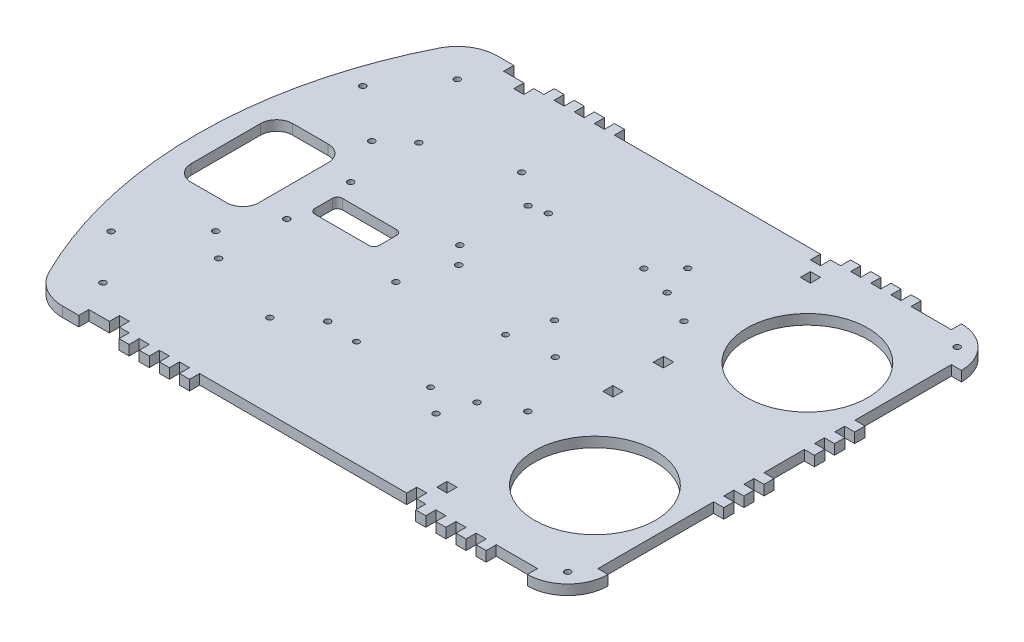
from build123d import *

# Parameters (mm, degrees)
MAIN_BASE_SKETCH_R   = 38.1
MAIN_BASE_SKETCH_R_2 = 1.905
MAIN_BASE_SKETCH_W   = 6.302603838
MAIN_BASE_SKETCH_H   = 6.555527471
MAIN_BASE_SKETCH_W_2 = 6.35
MAIN_BASE_SKETCH_H_2 = 6.35
MAIN_BASE_DEPTH      = 6.35
SKETCH1_R            = 1.905
SKETCH1_R_2          = 1.796
CUT_EXTRUDE1_DEPTH   = 257.294778557


with BuildPart() as part:
    # main_base_sketch → main_base (new body)
    with BuildSketch(Plane(origin=(0, 0, 0), x_dir=(1, 0, 0), z_dir=(0, 1, 0))):
        with BuildLine():
            Line((-94.961375831, 124.478458264), (-82.261375831, 124.478458264))
            Line((-82.261375831, 124.478458264), (-82.261375831, 118.128458264))
            Line((-82.261375831, 118.128458264), (-75.911375831, 118.128458264))
            Line((-75.911375831, 118.128458264), (-75.911375831, 124.478458264))
            Line((-75.911375831, 124.478458264), (-69.561375831, 124.478458264))
            Line((-69.561375831, 124.478458264), (-69.561375831, 130.828458264))
            Line((-69.561375831, 130.828458264), (-63.211375831, 130.828458264))
            Line((-63.211375831, 130.828458264), (-63.211375831, 124.478458264))
            Line((-63.211375831, 124.478458264), (-56.861375831, 124.478458264))
            Line((-56.861375831, 124.478458264), (-56.861375831, 130.828458264))
            Line((-56.861375831, 130.828458264), (-50.511375831, 130.828458264))
            Line((-50.511375831, 130.828458264), (-50.511375831, 124.478458264))
            Line((-50.511375831, 124.478458264), (-44.161375831, 124.478458264))
            Line((-44.161375831, 124.478458264), (-44.161375831, 130.828458264))
            Line((-44.161375831, 130.828458264), (-37.811375831, 130.828458264))
            Line((-37.811375831, 130.828458264), (-37.811375831, 124.478458264))
            Line((-37.811375831, 124.478458264), (-31.461375831, 124.478458264))
            Line((-31.461375831, 124.478458264), (-31.461375831, 130.828458264))
            Line((-31.461375831, 130.828458264), (-25.111375831, 130.828458264))
            Line((-25.111375831, 130.828458264), (-25.111375831, 124.478458264))
            Line((-25.111375831, 124.478458264), (104.775, 124.478458264))
            Line((104.775, 124.478458264), (104.775, 118.128458264))
            Line((104.775, 118.128458264), (111.125, 118.128458264))
            Line((111.125, 118.128458264), (111.125, 124.478458264))
            Line((111.125, 124.478458264), (117.475, 124.478458264))
            Line((117.475, 124.478458264), (117.475, 130.828458264))
            Line((117.475, 130.828458264), (123.825, 130.828458264))
            Line((123.825, 130.828458264), (123.825, 124.478458264))
            Line((123.825, 124.478458264), (130.175, 124.478458264))
            Line((130.175, 124.478458264), (130.175, 130.828458264))
            Line((130.175, 130.828458264), (136.525, 130.828458264))
            Line((136.525, 130.828458264), (136.525, 124.478458264))
            Line((136.525, 124.478458264), (142.875, 124.478458264))
            Line((142.875, 124.478458264), (142.875, 130.828458264))
            Line((142.875, 130.828458264), (149.225, 130.828458264))
            Line((149.225, 130.828458264), (149.225, 124.478458264))
            Line((149.225, 124.478458264), (155.575, 124.478458264))
            Line((155.575, 124.478458264), (155.575, 130.828458264))
            Line((155.575, 130.828458264), (161.925, 130.828458264))
            Line((161.925, 130.828458264), (161.925, 124.478458264))
            Line((161.925, 124.478458264), (187.325, 124.478458264))
            Line((187.325, 124.478458264), (187.325, 130.828458264))
            ThreePointArc((187.325, 130.828458264), (205.285512242, 123.388970506), (212.725, 105.428458264))
            Line((212.725, 105.428458264), (206.375, 105.428458264))
            Line((206.375, 105.428458264), (206.375, 44.655527471))
            Line((206.375, 44.655527471), (212.725, 44.655527471))
            Line((212.725, 44.655527471), (212.725, 38.1))
            Line((212.725, 38.1), (206.375, 38.1))
            Line((206.375, 38.1), (206.375, 31.955527471))
            Line((206.375, 31.955527471), (212.725, 31.955527471))
            Line((212.725, 31.955527471), (212.725, 25.4))
            Line((212.725, 25.4), (206.375, 25.4))
            Line((206.375, 25.4), (206.375, 24.179190074))
            Line((206.375, 24.179190074), (206.375, 19.255527471))
            Line((206.375, 19.255527471), (212.725, 19.255527471))
            Line((212.725, 19.255527471), (212.725, 12.7))
            Line((212.725, 12.7), (206.375, 12.7))
            Line((206.375, 12.7), (206.375, -12.7))
            Line((206.375, -12.7), (212.725, -12.7))
            Line((212.725, -12.7), (212.725, -19.05))
            Line((212.725, -19.05), (206.375, -19.05))
            Line((206.375, -19.05), (206.375, -25.4))
            Line((206.375, -25.4), (212.725, -25.4))
            Line((212.725, -25.4), (212.725, -31.75))
            Line((212.725, -31.75), (206.375, -31.75))
            Line((206.375, -31.75), (206.375, -38.1))
            Line((206.375, -38.1), (212.725, -38.1))
            Line((212.725, -38.1), (212.725, -44.45))
            Line((212.725, -44.45), (206.375, -44.45))
            Line((206.375, -44.45), (206.375, -117.410242597))
            Line((206.375, -117.410242597), (212.725, -117.410242597))
            ThreePointArc((212.725, -117.410242597), (205.285512242, -135.370754839), (187.325, -142.810242597))
            Line((187.325, -142.810242597), (187.325, -136.460242597))
            Line((187.325, -136.460242597), (161.284730748, -136.460242597))
            Line((161.284730748, -136.460242597), (161.284730748, -142.810242597))
            Line((161.284730748, -142.810242597), (154.934730748, -142.810242597))
            Line((154.934730748, -142.810242597), (154.934730748, -136.460242597))
            Line((154.934730748, -136.460242597), (148.584730748, -136.460242597))
            Line((148.584730748, -136.460242597), (148.584730748, -142.810242597))
            Line((148.584730748, -142.810242597), (142.234730748, -142.810242597))
            Line((142.234730748, -142.810242597), (142.234730748, -136.460242597))
            Line((142.234730748, -136.460242597), (135.884730748, -136.460242597))
            Line((135.884730748, -136.460242597), (135.884730748, -142.810242597))
            Line((135.884730748, -142.810242597), (129.534730748, -142.810242597))
            Line((129.534730748, -142.810242597), (129.534730748, -136.460242597))
            Line((129.534730748, -136.460242597), (123.184730748, -136.460242597))
            Line((123.184730748, -136.460242597), (123.184730748, -142.810242597))
            Line((123.184730748, -142.810242597), (116.834730748, -142.810242597))
            Line((116.834730748, -142.810242597), (116.834730748, -136.460242597))
            Line((116.834730748, -136.460242597), (111.125, -136.460242597))
            Line((111.125, -136.460242597), (111.125, -130.101785028))
            Line((111.125, -130.101785028), (104.775, -130.101785028))
            Line((104.775, -130.101785028), (104.775, -136.460242597))
            Line((104.775, -136.460242597), (-25.751645083, -136.460242597))
            Line((-25.751645083, -136.460242597), (-25.751645083, -142.810242597))
            Line((-25.751645083, -142.810242597), (-32.101645083, -142.810242597))
            Line((-32.101645083, -142.810242597), (-32.101645083, -136.460242597))
            Line((-32.101645083, -136.460242597), (-38.451645083, -136.460242597))
            Line((-38.451645083, -136.460242597), (-38.451645083, -142.810242597))
            Line((-38.451645083, -142.810242597), (-44.801645083, -142.810242597))
            Line((-44.801645083, -142.810242597), (-44.801645083, -136.460242597))
            Line((-44.801645083, -136.460242597), (-51.151645083, -136.460242597))
            Line((-51.151645083, -136.460242597), (-51.151645083, -142.810242597))
            Line((-51.151645083, -142.810242597), (-57.501645083, -142.810242597))
            Line((-57.501645083, -142.810242597), (-57.501645083, -136.460242597))
            Line((-57.501645083, -136.460242597), (-63.851645083, -136.460242597))
            Line((-63.851645083, -136.460242597), (-63.851645083, -142.810242597))
            Line((-63.851645083, -142.810242597), (-70.201645083, -142.810242597))
            Line((-70.201645083, -142.810242597), (-70.201645083, -136.460242597))
            Line((-70.201645083, -136.460242597), (-76.408932816, -136.460242597))
            Line((-76.408932816, -136.460242597), (-76.408932816, -130.101785028))
            Line((-76.408932816, -130.101785028), (-82.6643, -130.101785028))
            Line((-82.6643, -130.101785028), (-82.6643, -136.460242597))
            Line((-82.6643, -136.460242597), (-95.601645083, -136.460242597))
            Line((-95.601645083, -136.460242597), (-95.601645083, -142.810242597))
            Line((-95.601645083, -142.810242597), (-105.798207048, -142.810242597))
            ThreePointArc((-105.798207048, -142.810242597), (-119.167015715, -139.007347839), (-128.532661201, -128.737404395))
            ThreePointArc((-128.532661201, -128.737404395), (-157.286213724, -5.861503432), (-127.918775374, 116.869125935))
            ThreePointArc((-127.918775374, 116.869125935), (-118.556014486, 127.058910858), (-105.241228699, 130.828458264))
            Line((-105.241228699, 130.828458264), (-94.961375831, 130.828458264))
            Line((-94.961375831, 130.828458264), (-94.961375831, 124.478458264))
        make_face()
        with Locations((160.02, 60.978458264)):
            Circle(MAIN_BASE_SKETCH_R, mode=Mode.SUBTRACT)
        with Locations((160.02, -72.960242597)):
            Circle(MAIN_BASE_SKETCH_R, mode=Mode.SUBTRACT)
        with Locations((-131.296368682, 71.963600743)):
            Circle(MAIN_BASE_SKETCH_R_2, mode=Mode.SUBTRACT)
        with Locations((-131.296368682, -86.786399257)):
            Circle(MAIN_BASE_SKETCH_R_2, mode=Mode.SUBTRACT)
        with Locations((198.617679728, 116.869125935)):
            Circle(MAIN_BASE_SKETCH_R_2, mode=Mode.SUBTRACT)
        with Locations((198.617679728, -128.737404395)):
            Circle(MAIN_BASE_SKETCH_R_2, mode=Mode.SUBTRACT)
        with Locations((-105.241228699, 105.428458264)):
            Circle(MAIN_BASE_SKETCH_R_2, mode=Mode.SUBTRACT)
        with Locations((-105.798207048, -117.410242597)):
            Circle(MAIN_BASE_SKETCH_R_2, mode=Mode.SUBTRACT)
        with Locations((114.276301919, 15.977763736)):
            Rectangle(MAIN_BASE_SKETCH_W, MAIN_BASE_SKETCH_H, mode=Mode.SUBTRACT)
        with Locations((114.3, -15.875)):
            Rectangle(MAIN_BASE_SKETCH_W_2, MAIN_BASE_SKETCH_H_2, mode=Mode.SUBTRACT)
        with Locations((114.3, 108.603458264)):
            Rectangle(MAIN_BASE_SKETCH_W_2, MAIN_BASE_SKETCH_H_2, mode=Mode.SUBTRACT)
        with Locations((114.3, -120.585242597)):
            Rectangle(MAIN_BASE_SKETCH_W_2, MAIN_BASE_SKETCH_H_2, mode=Mode.SUBTRACT)
        with BuildLine():
            Line((-132.896346513, 29.385219085), (-110.497281748, 29.385219085))
            ThreePointArc((-110.497281748, 29.385219085), (-103.313076852, 26.409423982), (-100.337281748, 19.225219085))
            Line((-100.337281748, 19.225219085), (-100.337281748, -24.529097407))
            ThreePointArc((-100.337281748, -24.529097407), (-103.313076852, -31.713302304), (-110.497281748, -34.689097407))
            Line((-110.497281748, -34.689097407), (-132.896346513, -34.689097407))
            ThreePointArc((-132.896346513, -34.689097407), (-140.08055141, -31.713302304), (-143.056346513, -24.529097407))
            Line((-143.056346513, -24.529097407), (-143.056346513, 19.225219085))
            ThreePointArc((-143.056346513, 19.225219085), (-140.08055141, 26.409423982), (-132.896346513, 29.385219085))
        make_face(mode=Mode.SUBTRACT)
    extrude(amount=MAIN_BASE_DEPTH)

    # Sketch1 → Cut-Extrude1 (cut, through all)
    with BuildSketch(Plane(origin=(0, 6.35, 0), x_dir=(1, 0, 0), z_dir=(0, 1, 0))):
        with Locations((-82.6643, 58.691593479)):
            Circle(SKETCH1_R)
        with Locations((-13.8303, 58.691593479)):
            Circle(SKETCH1_R)
        with Locations((-3.2843, 60.939493479)):
            Circle(SKETCH1_R)
        with Locations((-13.8303, 15.689393479)):
            Circle(SKETCH1_R)
        with Locations((-3.2843, 4.475293479)):
            Circle(SKETCH1_R)
        with Locations((-82.6643, 15.689393479)):
            Circle(SKETCH1_R)
        with Locations((-82.6643, -24.620406521)):
            Circle(SKETCH1_R)
        with Locations((-13.8303, -24.620406521)):
            Circle(SKETCH1_R)
        with Locations((-82.6643, -67.622606521)):
            Circle(SKETCH1_R)
        with Locations((-13.8303, -67.622606521)):
            Circle(SKETCH1_R)
        with Locations((6.29, -69.601706521)):
            Circle(SKETCH1_R_2)
        with Locations((54.55, -71.189206521)):
            Circle(SKETCH1_R_2)
        with Locations((49.47, -18.801706521)):
            Circle(SKETCH1_R_2)
        with Locations((57.0407, 4.475293479)):
            Circle(SKETCH1_R)
        with Locations((57.0407, 60.939493479)):
            Circle(SKETCH1_R)
        with Locations((-98.425, 44.768293479)):
            Circle(SKETCH1_R)
        with Locations((-34.0871, 74.909493479)):
            Circle(SKETCH1_R)
        with Locations((70.6863, 74.909493479)):
            Circle(SKETCH1_R)
        with Locations((98.425, 44.768293479)):
            Circle(SKETCH1_R)
        with Locations((98.425, -53.699306521)):
            Circle(SKETCH1_R)
        with Locations((70.6863, -83.840506521)):
            Circle(SKETCH1_R)
        with Locations((-34.0871, -83.840506521)):
            Circle(SKETCH1_R)
        with Locations((-98.425, -53.699306521)):
            Circle(SKETCH1_R)
        with Locations((77.47, -64.790506521)):
            Circle(SKETCH1_R)
        with Locations((77.47, 55.065743479)):
            Circle(SKETCH1_R)
        with Locations((77.47, -15.419256521)):
            Circle(SKETCH1_R)
        with BuildLine():
            Line((-42.259046148, -13.14715688), (-76.408932816, -13.14715688))
            ThreePointArc((-76.408932816, -13.14715688), (-78.653996846, -12.21722091), (-79.583932816, -9.97215688))
            Line((-79.583932816, -9.97215688), (-79.583932816, 1.041143838))
            ThreePointArc((-79.583932816, 1.041143838), (-78.653996846, 3.286207868), (-76.408932816, 4.216143838))
            Line((-76.408932816, 4.216143838), (-42.259046148, 4.216143838))
            ThreePointArc((-42.259046148, 4.216143838), (-40.013982118, 3.286207868), (-39.084046148, 1.041143838))
            Line((-39.084046148, 1.041143838), (-39.084046148, -9.97215688))
            ThreePointArc((-39.084046148, -9.97215688), (-40.013982118, -12.21722091), (-42.259046148, -13.14715688))
        make_face()
    extrude(amount=-CUT_EXTRUDE1_DEPTH, mode=Mode.SUBTRACT)


solid = part.part
